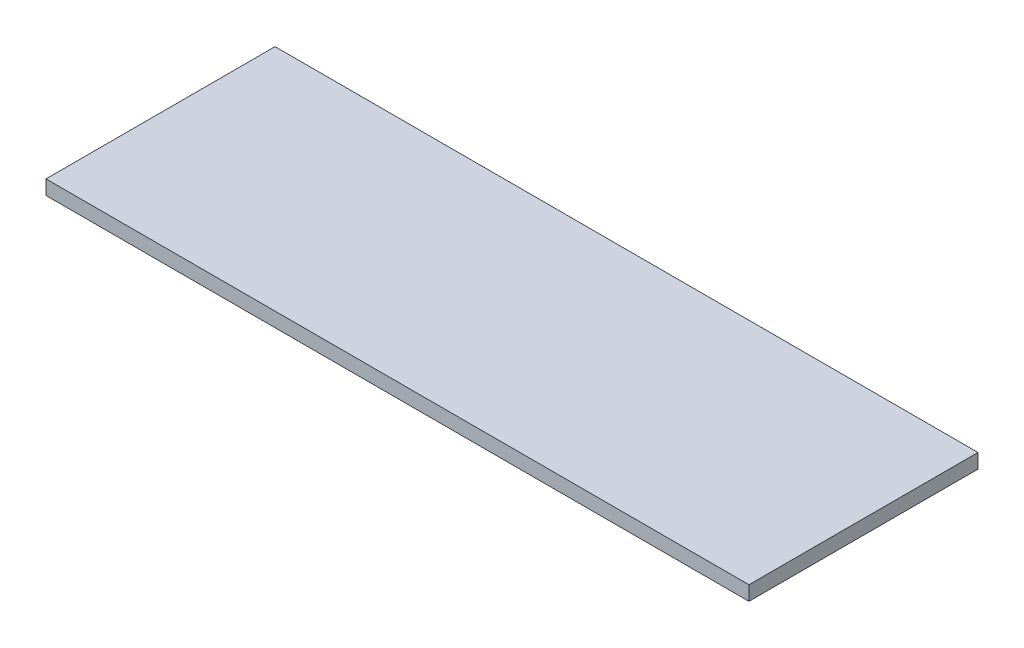
from build123d import *

# Parameters (mm, degrees)
SKETCH_1_W      = 244
SKETCH_1_H      = 79.5
EXTRUDE_1_DEPTH = 5


with BuildPart() as part:
    # 草图1 → 凸台-拉伸1 (new body)
    with BuildSketch(Plane(origin=(0, 0, 0), x_dir=(1, 0, 0), z_dir=(0, 1, 0))):
        with Locations((122, -39.75)):
            Rectangle(SKETCH_1_W, SKETCH_1_H)
    extrude(amount=EXTRUDE_1_DEPTH)


solid = part.part
